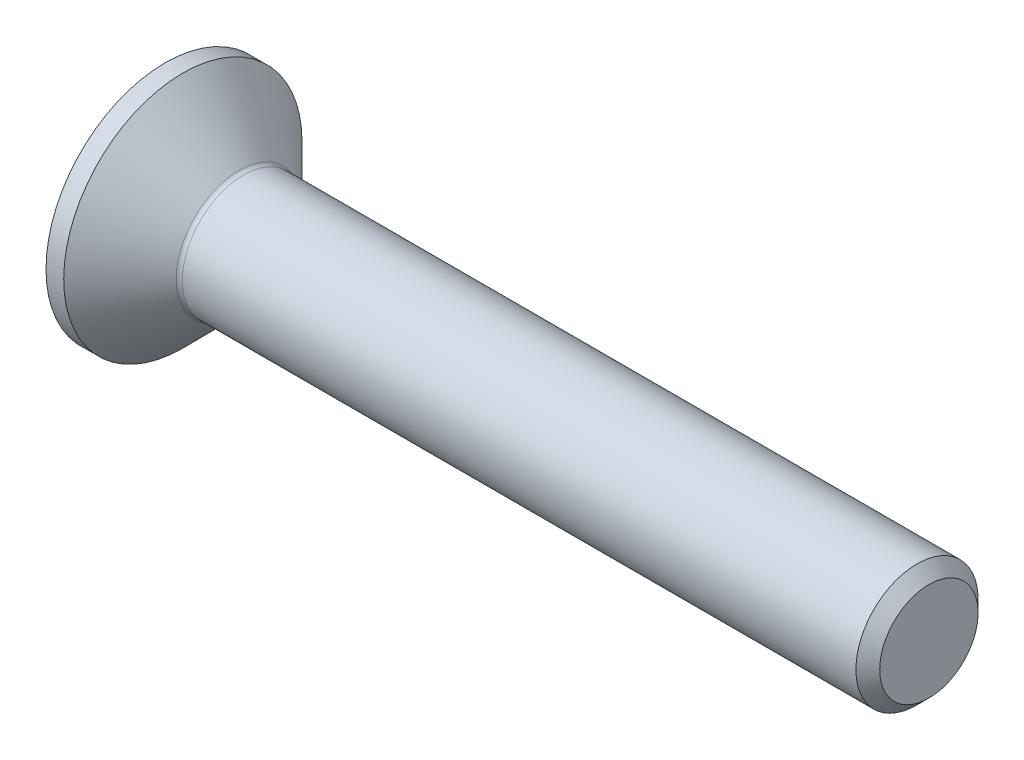
from build123d import *

# Parameters (mm, degrees)
FILLET1_R   = 0.2
HEX_START   = -1.5
HEX_2_DEPTH = 1.5


with BuildPart() as part:
    # BodySke → BaseBody (revolve)
    with BuildSketch(Plane.XY, mode=Mode.PRIVATE) as basebody_sk:
        Polygon((0, 0), (0, 3.9), (0.58, 3.9), (2.48, 2), (24.61, 2), (25, 1.61), (25, 0), align=None)
    revolve(basebody_sk.sketch.rotate(Axis((0, 0, 0), (1, 0, 0)), 90), axis=Axis((0, 0, 0), (1, 0, 0)))

    # Fillet1
    fillet1_edges = [part.edges().sort_by_distance(p)[0] for p in [
        (2.48, 0, -2),
    ]]
    fillet(fillet1_edges, radius=FILLET1_R)

    # Hex 2: read off the stored shape, not the designer's step
    # Hex 2 outline → Hex 2 (cut)
    with BuildSketch(Plane.ZY.offset(HEX_START)):
        Polygon((-1.25, -0.721687836), (0, -1.443375673), (1.25, -0.721687836), (1.25, 0.721687836), (0, 1.443375673), (-1.25, 0.721687836), align=None)
    extrude(amount=HEX_2_DEPTH, mode=Mode.SUBTRACT)

    # Hex 2 2 outline → Hex 2 2 (revolve, cut)
    with BuildSketch(Plane.YX):
        Polygon((1.25, 1.5), (0, 2.221687836), (0, 1.5), align=None)
    revolve(axis=Axis((0, 0, 0), (1, 0, 0)), mode=Mode.SUBTRACT)


solid = part.part
